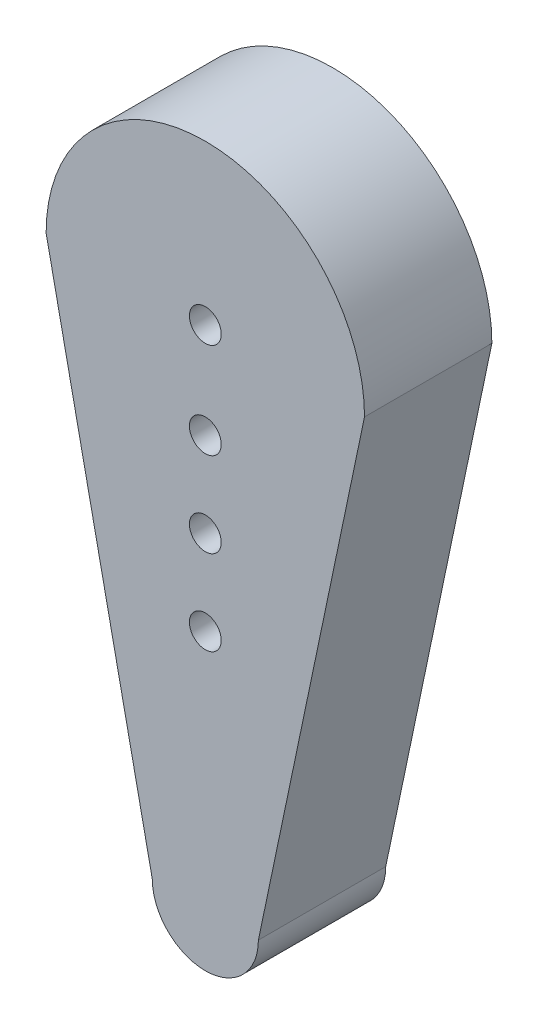
from build123d import *

# Parameters (mm, degrees)
BOSS_EXTRUDE1_DEPTH     = 6
CUT_EXTRUDE3_DEPTH      = 4.7
CUT_EXTRUDE4_DEPTH      = 28.796807371
CUT_EXTRUDE4_DEPTH_BACK = 28.796807371
SKETCH4_R               = 0.75
SKETCH6_R               = 0.75
CUT_EXTRUDE6_DEPTH      = 28.796807371
LPATTERN1_COUNT         = 3
LPATTERN1_PITCH         = 4


with BuildPart() as part:
    # Sketch2 → Boss-Extrude1 (new body)
    with BuildSketch(Plane.XY):
        with BuildLine():
            Line((-7.5, 0), (-2.5, -23.85))
            ThreePointArc((-2.5, -23.85), (0, -26.35), (2.5, -23.85))
            Line((2.5, -23.85), (7.5, 0))
            ThreePointArc((7.5, 0), (0, 7.5), (-7.5, 0))
        make_face()
    extrude(amount=BOSS_EXTRUDE1_DEPTH)

    # Sketch3 → Cut-Extrude3 (cut)
    with BuildSketch(Plane.XY):
        with BuildLine():
            Line((-3.75, 0), (-2.25, -15))
            ThreePointArc((-2.25, -15), (0, -17.25), (2.25, -15))
            Line((2.25, -15), (3.75, 0))
            ThreePointArc((3.75, 0), (0, 3.75), (-3.75, 0))
        make_face()
    extrude(amount=CUT_EXTRUDE3_DEPTH, mode=Mode.SUBTRACT)

    # Sketch4 → Cut-Extrude4 (cut, two sides: drawn at the far end of the back side and taken through both)
    with BuildSketch(Plane(origin=(0, 0, 4.7), x_dir=(-1, 0, 0), z_dir=(0, 0, -1)).offset(-CUT_EXTRUDE4_DEPTH_BACK)):
        Circle(SKETCH4_R)
    extrude(amount=CUT_EXTRUDE4_DEPTH + CUT_EXTRUDE4_DEPTH_BACK, mode=Mode.SUBTRACT)

    # Sketch6 → Cut-Extrude6 (cut, symmetric)
    with BuildSketch(Plane(origin=(0, 0, 4.7), x_dir=(-1, 0, 0), z_dir=(0, 0, -1))):
        with Locations((0, -4.5)):
            Circle(SKETCH6_R)
    cut_extrude6 = extrude(amount=CUT_EXTRUDE6_DEPTH, both=True, mode=Mode.SUBTRACT)

    # LPattern1: Cut-Extrude6 ×3
    with Locations(*[(0, -i * LPATTERN1_PITCH, 0) for i in range(1, LPATTERN1_COUNT)]):
        add(cut_extrude6, mode=Mode.SUBTRACT)


solid = part.part
